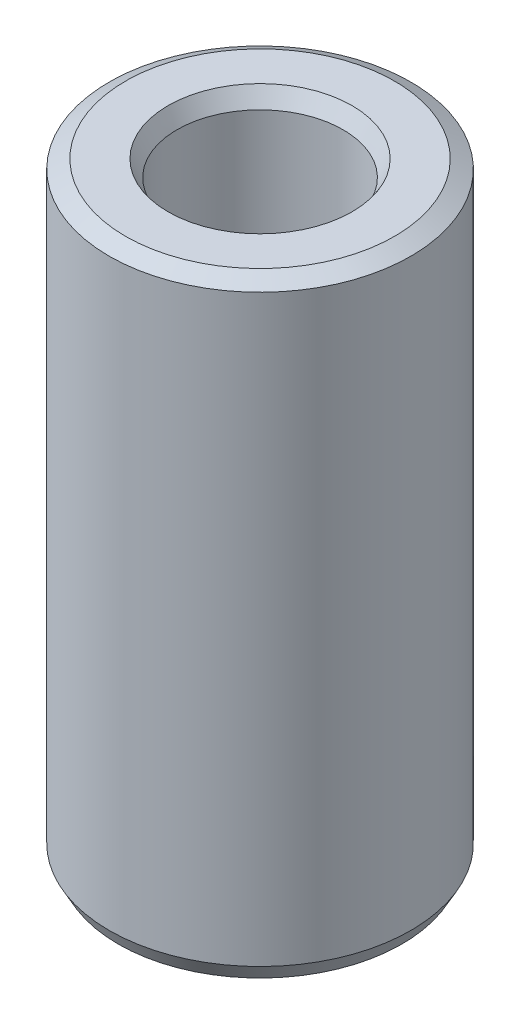
from build123d import *
from OCP.BRepFilletAPI import BRepFilletAPI_MakeChamfer

# Parameters (mm, degrees)
SKETCH1_R           = 35
BOSS_EXTRUDE1_DEPTH = 141.361519134
SKETCH2_R           = 19.259413062
CUT_EXTRUDE1_DEPTH  = 150.776764192
CHAMFER1_SIZE       = 2.089936292
CHAMFER1_SIZE2      = 3.794054727


with BuildPart() as part:
    # Sketch1 → Boss-Extrude1 (new body)
    with BuildSketch(Plane(origin=(0, 0, 0), x_dir=(1, 0, 0), z_dir=(0, 1, 0))):
        Circle(SKETCH1_R)
    extrude(amount=BOSS_EXTRUDE1_DEPTH)

    # Sketch2 → Cut-Extrude1 (cut, through all)
    with BuildSketch(Plane(origin=(0, 0, 0), x_dir=(1, 0, 0), z_dir=(0, 1, 0))):
        Circle(SKETCH2_R)
    extrude(amount=CUT_EXTRUDE1_DEPTH, mode=Mode.SUBTRACT)

    # Chamfer1: one chamfer whose edges measure the first distance from different faces: ONE call of the kernel's chamfer builder (chamfer() names one face for all edges)
    chamfer1_edges_1 = [part.edges().sort_by_distance(p)[0] for p in [
        (-19.259413062, 141.361519134, 0),
    ]]
    chamfer1_side_1 = [part.faces().sort_by_distance(p)[0] for p in [
        (-34.010050506, 141.361519134, 0),
    ]]
    chamfer1_edges_2 = [part.edges().sort_by_distance(p)[0] for p in [
        (-19.259413062, 0, 0),
    ]]
    chamfer1_side_2 = [part.faces().sort_by_distance(p)[0] for p in [
        (-19.259413062, 70.680759567, 0),
    ]]
    chamfer1_edges_3 = [part.edges().sort_by_distance(p)[0] for p in [
        (-35, 0, 0),
    ]]
    chamfer1_side_3 = [part.faces().sort_by_distance(p)[0] for p in [
        (-34.010050506, 0, 0),
    ]]
    chamfer1_edges_4 = [part.edges().sort_by_distance(p)[0] for p in [
        (-35, 141.361519134, 0),
    ]]
    chamfer1_side_4 = [part.faces().sort_by_distance(p)[0] for p in [
        (-35, 70.680759567, 0),
    ]]
    chamfer1 = BRepFilletAPI_MakeChamfer(part.part.solid().wrapped)
    for e in chamfer1_edges_1:
        chamfer1.Add(CHAMFER1_SIZE, CHAMFER1_SIZE2, e.wrapped, chamfer1_side_1[0].wrapped)  # the first distance lies on this face
    for e in chamfer1_edges_2:
        chamfer1.Add(CHAMFER1_SIZE, CHAMFER1_SIZE2, e.wrapped, chamfer1_side_2[0].wrapped)  # the first distance lies on this face
    for e in chamfer1_edges_3:
        chamfer1.Add(CHAMFER1_SIZE, CHAMFER1_SIZE2, e.wrapped, chamfer1_side_3[0].wrapped)  # the first distance lies on this face
    for e in chamfer1_edges_4:
        chamfer1.Add(CHAMFER1_SIZE, CHAMFER1_SIZE2, e.wrapped, chamfer1_side_4[0].wrapped)  # the first distance lies on this face
    add(Compound.cast(chamfer1.Shape()), mode=Mode.REPLACE)


solid = part.part
